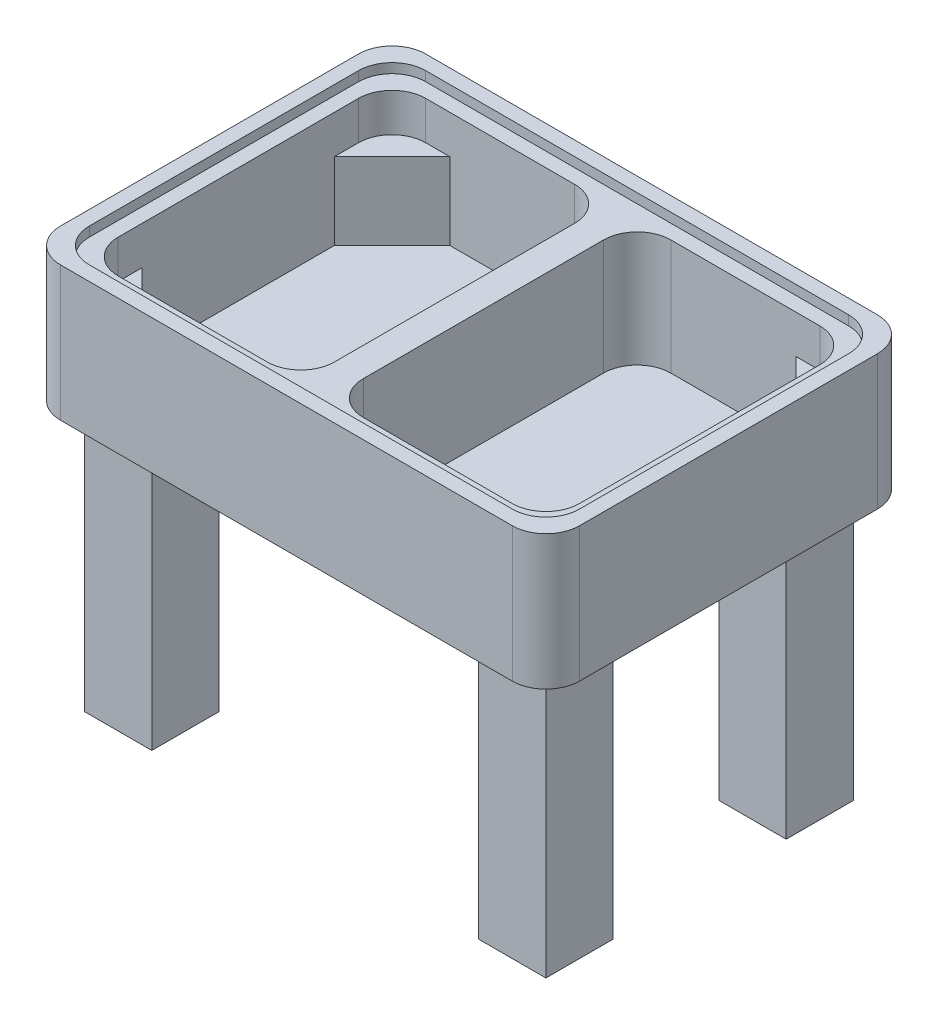
from build123d import *

# Parameters (mm, degrees)
SKETCH1_W           = 540
SKETCH1_H           = 380
BOSS_EXTRUDE1_DEPTH = 140
SKETCH3_W           = 510
SKETCH3_H           = 350
CUT_EXTRUDE1_DEPTH  = 10
SKETCH2_W           = 225
SKETCH2_H           = 320
CUT_EXTRUDE2_DEPTH  = 40
CUT_EXTRUDE3_DEPTH  = 80
FILLET1_R           = 35
SKETCH6_W           = 70
SKETCH6_H           = 70
BOSS_EXTRUDE2_DEPTH = 280


with BuildPart() as part:
    # Sketch1 → Boss-Extrude1 (new body)
    with BuildSketch(Plane(origin=(0, 0, 0), x_dir=(1, 0, 0), z_dir=(0, 1, 0))):
        with Locations((270, 190)):
            Rectangle(SKETCH1_W, SKETCH1_H)
    extrude(amount=-BOSS_EXTRUDE1_DEPTH)

    # Sketch3 → Cut-Extrude1 (cut)
    with BuildSketch(Plane(origin=(0, 0, 0), x_dir=(1, 0, 0), z_dir=(0, 1, 0))):
        with Locations((270, 190)):
            Rectangle(SKETCH3_W, SKETCH3_H)
    extrude(amount=-CUT_EXTRUDE1_DEPTH, mode=Mode.SUBTRACT)

    # Sketch2 → Cut-Extrude2 (cut)
    with BuildSketch(Plane(origin=(0, -10, 0), x_dir=(1, 0, 0), z_dir=(0, 1, 0))):
        with Locations((142.5, 190)):
            Rectangle(SKETCH2_W, SKETCH2_H)
        with Locations((397.5, 190)):
            Rectangle(SKETCH2_W, SKETCH2_H)
    extrude(amount=-CUT_EXTRUDE2_DEPTH, mode=Mode.SUBTRACT)

    # Sketch5 → Cut-Extrude3 (cut)
    with BuildSketch(Plane(origin=(0, -50, 0), x_dir=(1, 0, 0), z_dir=(0, 1, 0))):
        Polygon((30, 290), (90, 350), (255, 350), (255, 30), (90, 30), (30, 90), align=None)
        Polygon((510, 90), (450, 30), (285, 30), (285, 350), (450, 350), (510, 290), align=None)
    extrude(amount=-CUT_EXTRUDE3_DEPTH, mode=Mode.SUBTRACT)

    # Fillet1
    fillet1_edges = [part.edges().sort_by_distance(p)[0] for p in [
        (285, -70, -30),
        (255, -70, -30),
        (525, -5, -15),
        (510, -30, -30),
        (510, -30, -350),
        (525, -5, -365),
        (285, -70, -350),
        (255, -70, -350),
        (30, -30, -350),
        (15, -5, -365),
        (30, -30, -30),
        (15, -5, -15),
        (0, -70, 0),
        (540, -70, 0),
        (540, -70, -380),
        (0, -70, -380),
    ]]
    fillet(fillet1_edges, radius=FILLET1_R)

    # Sketch6 → Boss-Extrude2 (add)
    with BuildSketch(Plane.XZ.offset(140)):
        with Locations((65, -65)):
            Rectangle(SKETCH6_W, SKETCH6_H)
        with Locations((475, -65)):
            Rectangle(SKETCH6_W, SKETCH6_H)
        with Locations((475, -315)):
            Rectangle(SKETCH6_W, SKETCH6_H)
        with Locations((65, -315)):
            Rectangle(SKETCH6_W, SKETCH6_H)
    extrude(amount=BOSS_EXTRUDE2_DEPTH)


solid = part.part
